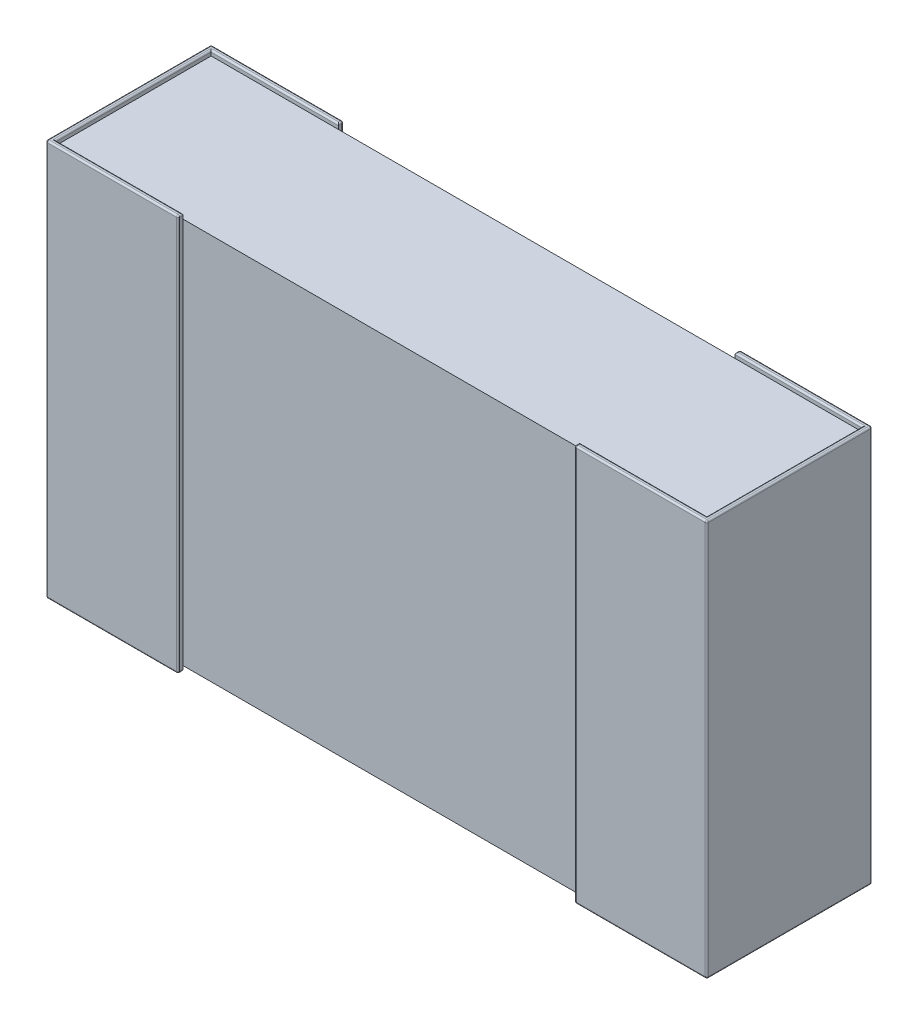
from build123d import *

# Parameters (mm, degrees)
SKETCH_1_W          = 2
SKETCH_1_H          = 1.2
EXTRUDE_1_DEPTH     = 0.47
SKETCH_2_W          = 0.4
SKETCH_2_H          = 1.2
EXTRUDE_2_DEPTH     = 0.015
SKETCH_3_W          = 0.4
SKETCH_3_H          = 1.2
EXTRUDE_3_DEPTH     = 0.015
SKETCH_4_W          = 1.97
SKETCH_4_H          = 0.47
CUT_EXTRUDE_1_DEPTH = 0.015
SKETCH_5_W          = 1.97
SKETCH_5_H          = 0.47
CUT_EXTRUDE_2_DEPTH = 0.015
FILLET_1_R          = 0.005


with BuildPart() as part:
    # Эскиз1 → Бобышка-Вытянуть1 (new body)
    with BuildSketch(Plane.XY):
        Rectangle(SKETCH_1_W, SKETCH_1_H)
    extrude(amount=EXTRUDE_1_DEPTH)

    # Эскиз2 → Бобышка-Вытянуть2 (add)
    with BuildSketch(Plane.XY.offset(0.47)):
        with Locations((-0.8, 0)):
            Rectangle(SKETCH_2_W, SKETCH_2_H)
        with Locations((0.8, 0)):
            Rectangle(SKETCH_2_W, SKETCH_2_H)
    extrude(amount=EXTRUDE_2_DEPTH)

    # Эскиз3 → Бобышка-Вытянуть3 (add)
    with BuildSketch(Plane(origin=(0, 0, 0), x_dir=(-1, 0, 0), z_dir=(0, 0, -1))):
        with Locations((-0.8, 0)):
            Rectangle(SKETCH_3_W, SKETCH_3_H)
        with Locations((0.8, 0)):
            Rectangle(SKETCH_3_W, SKETCH_3_H)
    extrude(amount=EXTRUDE_3_DEPTH)

    # Эскиз4 → Вырез-Вытянуть1 (cut)
    with BuildSketch(Plane.XZ.offset(0.6)):
        with Locations((0, 0.235)):
            Rectangle(SKETCH_4_W, SKETCH_4_H)
    extrude(amount=-CUT_EXTRUDE_1_DEPTH, mode=Mode.SUBTRACT)

    # Эскиз5 → Вырез-Вытянуть2 (cut)
    with BuildSketch(Plane(origin=(0, 0.6, 0), x_dir=(1, 0, 0), z_dir=(0, 1, 0))):
        with Locations((0, -0.235)):
            Rectangle(SKETCH_5_W, SKETCH_5_H)
    extrude(amount=-CUT_EXTRUDE_2_DEPTH, mode=Mode.SUBTRACT)

    # Скругление1
    fillet_1_edges = [part.edges().sort_by_distance(p)[0] for p in [
        (0.985, 0.6, 0.235),
        (0.7925, 0.6, 0),
        (-0.7925, 0.6, 0),
        (-0.985, 0.6, 0.235),
        (-0.7925, 0.6, 0.47),
        (0.7925, 0.6, 0.47),
        (-0.6, -0.6, 0.4775),
        (-0.6, 0.6, 0.4775),
        (-1, 0, 0.485),
        (-0.8, -0.6, 0.485),
        (-0.6, 0, 0.485),
        (-0.8, 0.6, 0.485),
        (0.6, 0.6, 0.4775),
        (0.6, -0.6, 0.4775),
        (0.8, 0.6, 0.485),
        (0.6, 0, 0.485),
        (0.8, -0.6, 0.485),
        (1, 0, 0.485),
        (0.6, -0.6, -0.0075),
        (0.6, 0.6, -0.0075),
        (1, 0, -0.015),
        (0.8, -0.6, -0.015),
        (0.6, 0, -0.015),
        (0.8, 0.6, -0.015),
        (-0.6, 0.6, -0.0075),
        (-0.6, -0.6, -0.0075),
        (-0.8, 0.6, -0.015),
        (-0.6, 0, -0.015),
        (-0.8, -0.6, -0.015),
        (-1, 0, -0.015),
        (1, -0.6, 0.235),
        (-1, -0.6, 0.235),
        (0.985, -0.6, 0.235),
        (0.7925, -0.6, 0.47),
        (-1, 0.6, 0.235),
        (-0.7925, -0.6, 0.47),
        (-0.985, -0.6, 0.235),
        (-0.7925, -0.6, 0),
        (1, 0.6, 0.235),
        (0.7925, -0.6, 0),
    ]]
    fillet(fillet_1_edges, radius=FILLET_1_R)


with BuildPart() as part_1:
    # Move Body 2: read off the stored shape, not the designer's step
    # Move Body 2: moved
    add(part.part.moved(Location((0.8, 0, 0.015))))


solid = part_1.part
